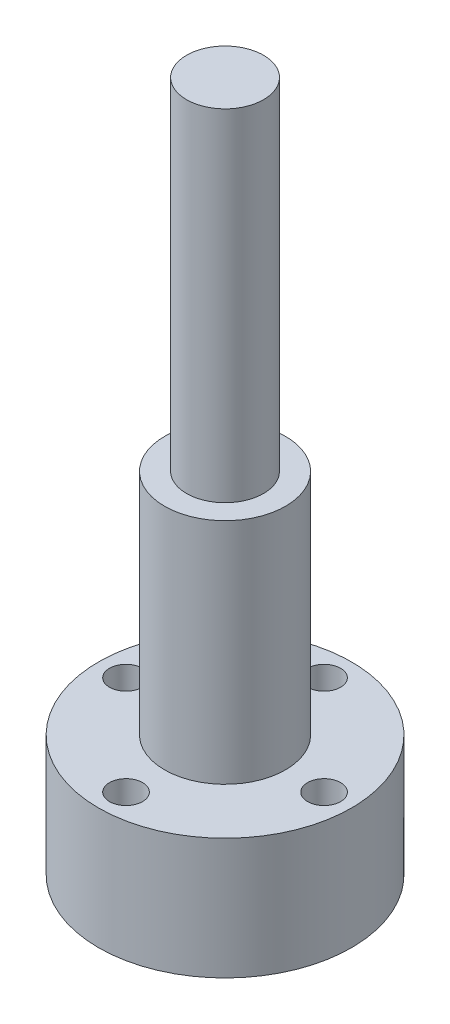
from build123d import *

# Parameters (mm, degrees)
SZKIC2_R                   = 3
WYTNIJ_WYCI_GNI_CIE1_DEPTH = 130.646635128


with BuildPart() as part:
    # Szkic1 → Obrót1 (revolve)
    with BuildSketch(Plane.XY):
        Polygon((-7, 2), (-7, 0), (0, 0), (0, 127.5), (-7, 127.5), (-7, 65.5), (-11, 65.5), (-11, 24), (-23, 24), (-23, 2), align=None)
    revolve(axis=Axis((0, 127.5, 0), (0, -1, 0)))

    # Szkic2 → Wytnij-wyciągnięcie1 (cut, through all)
    with BuildSketch(Plane.XZ.offset(-2)):
        with Locations((0, 18)):
            Circle(SZKIC2_R)
        with Locations((18, 0)):
            Circle(SZKIC2_R)
        with Locations((0, -18)):
            Circle(SZKIC2_R)
        with Locations((-18, 0)):
            Circle(SZKIC2_R)
    extrude(amount=-WYTNIJ_WYCI_GNI_CIE1_DEPTH, mode=Mode.SUBTRACT)


solid = part.part
